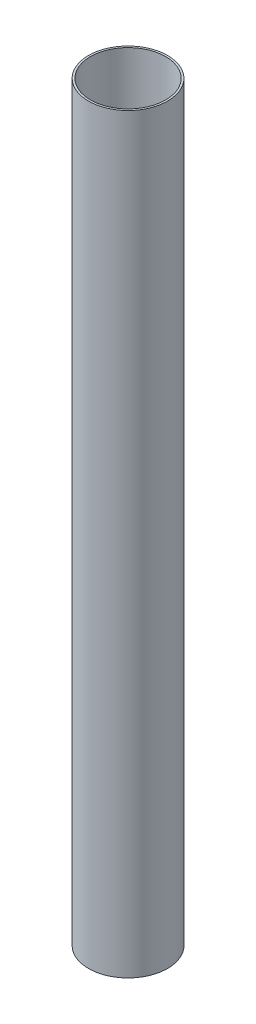
from build123d import *

# Parameters (mm, degrees)
SKETCH1_R   = 25.4
SKETCH1_R_2 = 24.1554
BODY_DEPTH  = 482.6


with BuildPart() as part:
    # Sketch1 → body (new body)
    with BuildSketch(Plane(origin=(0, 0, 0), x_dir=(1, 0, 0), z_dir=(0, 1, 0))):
        Circle(SKETCH1_R)
        Circle(SKETCH1_R_2, mode=Mode.SUBTRACT)
    extrude(amount=BODY_DEPTH)


solid = part.part
